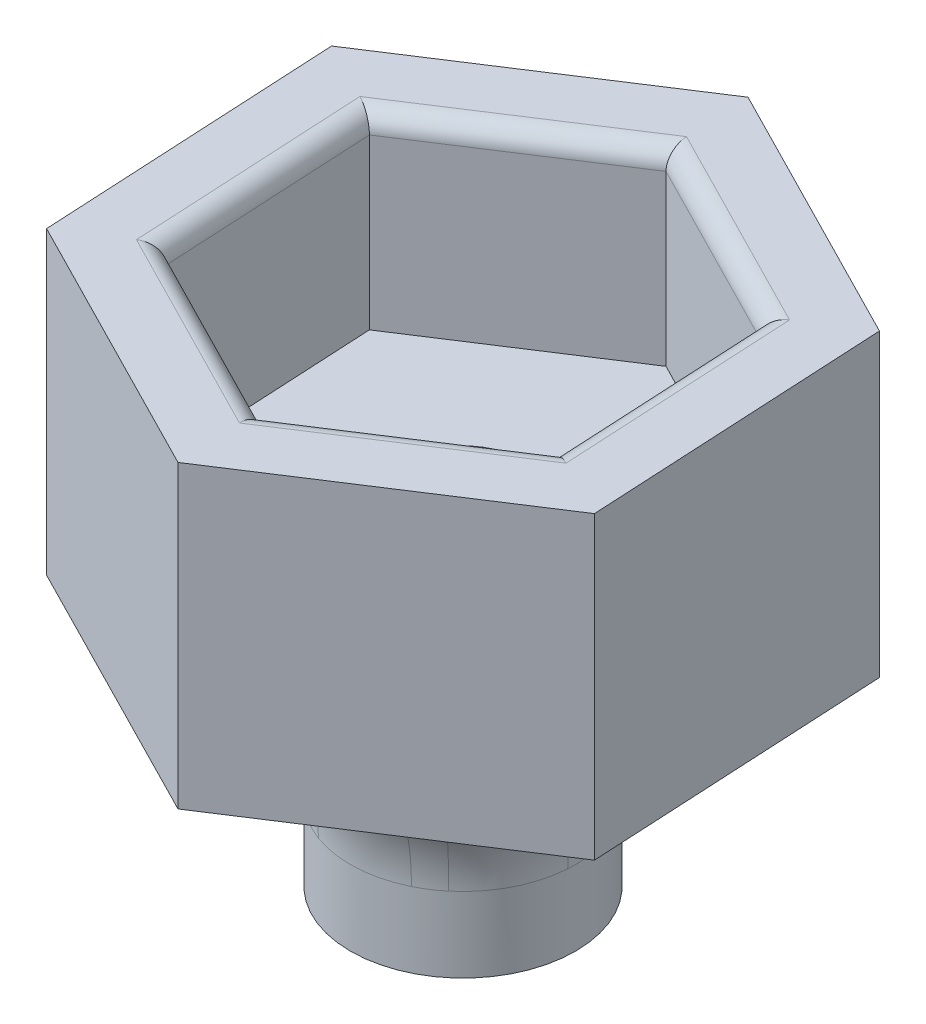
from build123d import *

# Parameters (mm, degrees)
SKETCH1_R           = 3
BOSS_EXTRUDE1_DEPTH = 9
BOSS_EXTRUDE2_DEPTH = 5
BOSS_EXTRUDE3_START = -3
SKETCH2_3_R         = 3
BOSS_EXTRUDE3_DEPTH = 3
FILLET1_R           = 4
FILLET2_R           = 0.5


with BuildPart() as part:
    # Sketch1 → Boss-Extrude1 (new body)
    with BuildSketch(Plane(origin=(0, 0, 0), x_dir=(1, 0, 0), z_dir=(0, 1, 0))):
        Circle(SKETCH1_R)
        with BuildLine():
            ThreePointArc((1.65, 0), (-0.588756448, -1.541384392), (-1.229837388, 1.1))
            ThreePointArc((-1.229837388, 1.1), (0, 1.65), (1.229837388, 1.1))
            ThreePointArc((1.229837388, 1.1), (1.541384392, 0.588756448), (1.65, 0))
        make_face(mode=Mode.SUBTRACT)
    extrude(amount=BOSS_EXTRUDE1_DEPTH)



with BuildPart() as body_2:
    # Sketch2 → Boss-Extrude2 (new body)
    with BuildSketch(Plane(origin=(0, 9, 0), x_dir=(1, 0, 0), z_dir=(0, 1, 0))):
        Polygon((-0.41717713, 8.014318223), (-7.14919174, 3.645873119), (-6.73201461, -4.368445104), (0.41717713, -8.014318223), (7.14919174, -3.645873119), (6.73201461, 4.368445104), align=None)
        Polygon((-4.794744219, -3.111338599), (0.297126157, -5.708039598), (5.091870376, -2.596700998), (4.794744219, 3.111338599), (-0.297126157, 5.708039598), (-5.091870376, 2.596700998), align=None, mode=Mode.SUBTRACT)
    extrude(amount=BOSS_EXTRUDE2_DEPTH)


with BuildPart() as part_1:
    add(part.part)

    add(body_2.part)  # Boss-Extrude3 merges body 2
    # Sketch2<3> → Boss-Extrude3 (add)
    with BuildSketch(Plane(origin=(0, 9, 0), x_dir=(1, 0, 0), z_dir=(0, 1, 0)).offset(BOSS_EXTRUDE3_START)):
        Polygon((6.73201461, 4.368445104), (-0.41717713, 8.014318223), (-7.14919174, 3.645873119), (-6.73201461, -4.368445104), (0.41717713, -8.014318223), (7.14919174, -3.645873119), align=None)
        Circle(SKETCH2_3_R, mode=Mode.SUBTRACT)
    extrude(amount=BOSS_EXTRUDE3_DEPTH)

    # Fillet1
    fillet1_edges = [part_1.edges().sort_by_distance(p)[0] for p in [
        (-3, 6, 0),
    ]]
    fillet(fillet1_edges, radius=FILLET1_R)

    # Fillet2
    fillet2_edges = [part_1.edges().sort_by_distance(p)[0] for p in [
        (4.943307297, 14, -0.2573188),
        (2.694498267, 14, 4.152370298),
        (-2.248809031, 14, 4.409689098),
        (2.248809031, 14, -4.409689098),
        (-2.694498267, 14, -4.152370298),
        (-4.943307297, 14, 0.2573188),
    ]]
    fillet(fillet2_edges, radius=FILLET2_R)


solid = part_1.part
